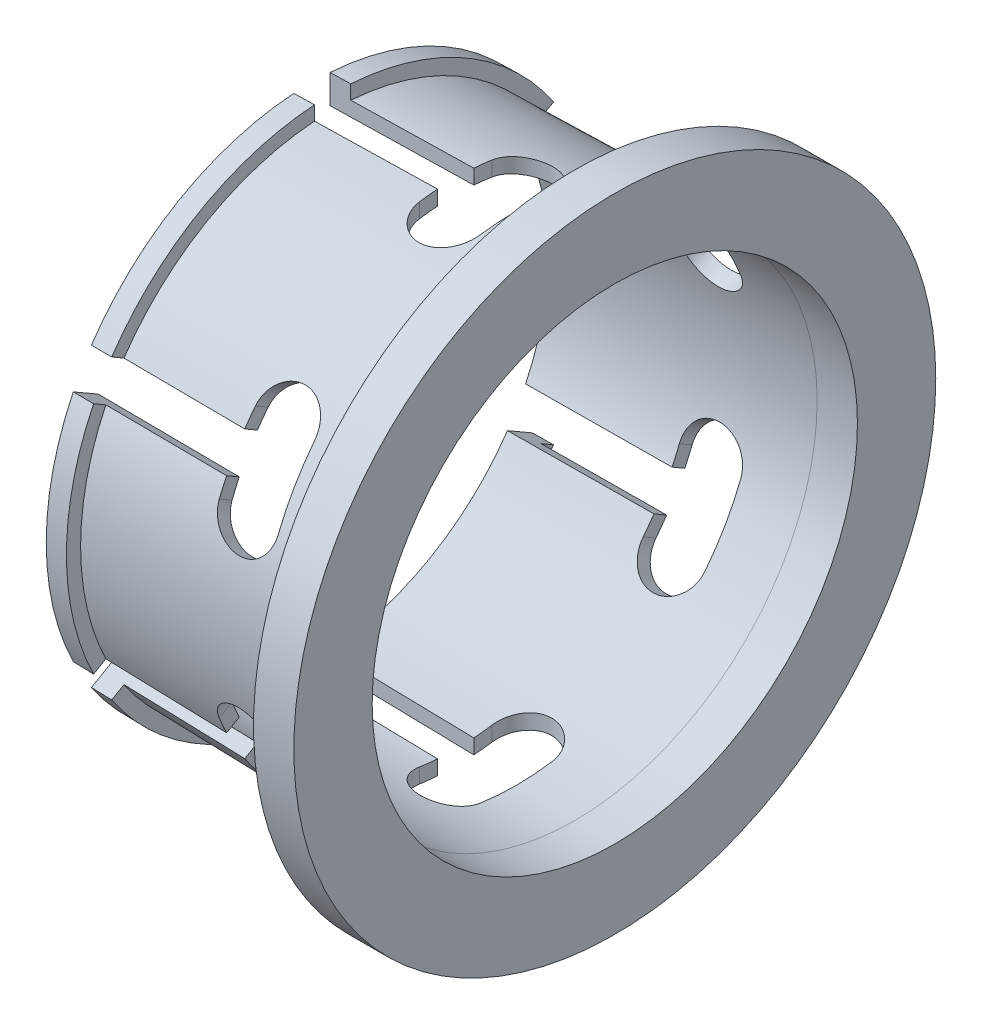
from build123d import *

# Parameters (mm, degrees)
CUT_EXTRUDE1_REACH = 173.937
CIRPATTERN1_COUNT  = 6


with BuildPart() as part:
    # Sketch3 → Revolve1 (revolve)
    with BuildSketch(Plane.XY):
        Polygon((0, 76.454), (-12.7, 76.454), (-95.426089867, 74.655606705), (-95.426089867, 83.725671532), (-88.916030092, 83.867194574), (-88.916030092, 79.409655253), (-12.7, 81.066525507), (-12.7, 101.133908192), (0, 101.133908192), align=None)
    revolve(axis=Axis((0, 0, 0), (-1, 0, 0)))

    # Cut-Extrude1: up to this cone (the profile starts inside it)
    cut_extrude1_end = Plane(origin=(-54.113115, 0, 0), z_dir=(1, 0, 0)) * Cone(78.992023502, 90.255535898, 518.1215594, mode=Mode.PRIVATE)
    # Sketch4 → Cut-Extrude1 (cut, up to the surface)
    with BuildSketch(Plane(origin=(0, 0, 0), x_dir=(1, 0, 0), z_dir=(0, 1, 0)), mode=Mode.PRIVATE) as cut_extrude1_sk1:
        with BuildLine():
            Line((-95.426089867, 5.715), (-95.426089867, -5.715))
            Line((-95.426089867, -5.715), (-50.130677034, -5.715))
            Line((-50.130677034, -5.715), (-50.130677034, -11.384258727))
            ThreePointArc((-50.130677034, -11.384258727), (-40.62678108, -20.888154681), (-31.122885127, -11.384258727))
            Line((-31.122885127, -11.384258727), (-31.122885127, 11.384258727))
            ThreePointArc((-31.122885127, 11.384258727), (-40.62678108, 20.888154681), (-50.130677034, 11.384258727))
            Line((-50.130677034, 11.384258727), (-50.130677034, 5.715))
            Line((-50.130677034, 5.715), (-95.426089867, 5.715))
        make_face()
    cut_extrude1_tool1 = extrude(cut_extrude1_sk1.sketch, amount=-CUT_EXTRUDE1_REACH, mode=Mode.PRIVATE) & cut_extrude1_end
    cut_extrude1 = cut_extrude1_tool1.solids().sort_by_distance((-54.113115, 0, 0))[0]
    add(cut_extrude1, mode=Mode.SUBTRACT)

    # CirPattern1: Cut-Extrude1 ×6 about axis
    cirpattern1_axis = Axis((-95.426089867, 0, 0), (-1, 0, 0))
    for i in range(1, CIRPATTERN1_COUNT):
        add(cut_extrude1.rotate(cirpattern1_axis, i * 360 / CIRPATTERN1_COUNT), mode=Mode.SUBTRACT)


solid = part.part
